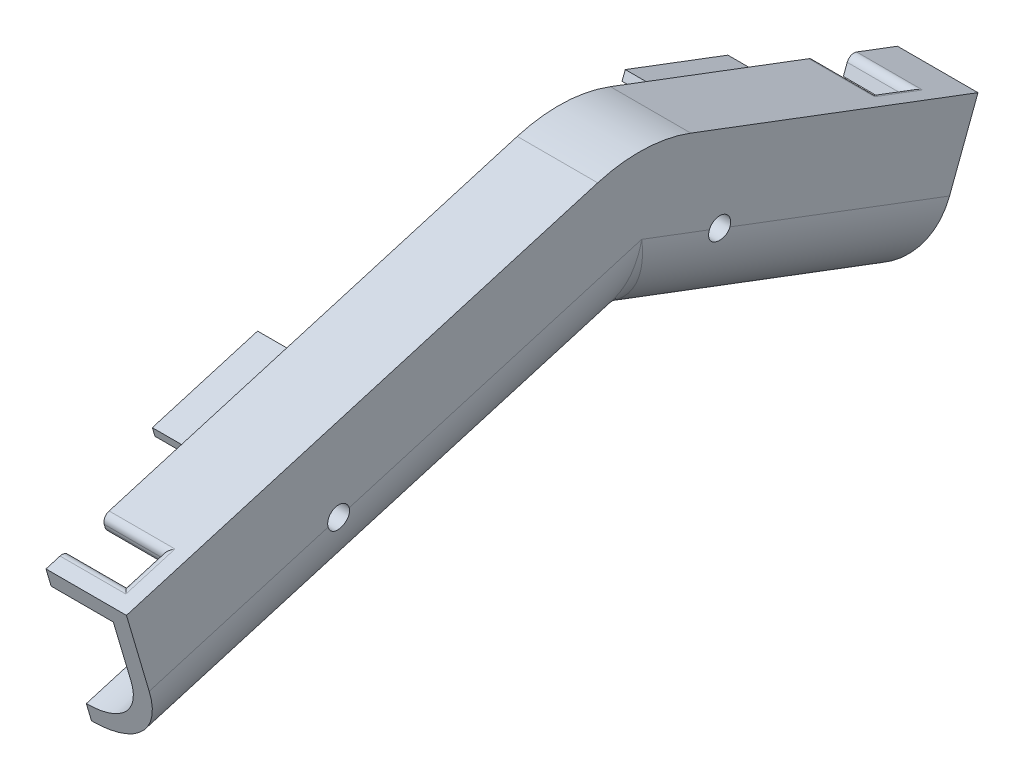
from build123d import *

# Parameters (mm, degrees)
SWEEP1_PROFILE_R        = 11
CUT_EXTRUDE1_DEPTH      = 139.5211963076765
CUT_EXTRUDE1_DEPTH_BACK = 139.5211963076765
BOSS_EXTRUDE1_DEPTH     = 11
BOSS_EXTRUDE4_DEPTH     = 11
SHELL1_START            = -11
SHELL1_DEPTH            = 11
SHELL1_START_2          = -113.150665538
SHELL1_2_DEPTH          = 47.855548818
SHELL1_START_3          = 20.420083618
SHELL1_3_DEPTH          = 73.048431747
FILLET1_R               = 6.5
BOSS_EXTRUDE2_DEPTH     = 3
CUT_EXTRUDE2_DEPTH      = 13.000000000000002
SKETCH21_R              = 2.499999999999935
SKETCH21_R_2            = 2.499999999999995
BOSS_EXTRUDE3_DEPTH     = 2
SKETCH22_R              = 1.4999999999999973
SKETCH22_R_2            = 1.5000000000000042
CUT_EXTRUDE3_DEPTH      = 160.1425622502868
FILLET2_R               = 3.75
CUT_EXTRUDE4_DEPTH      = 3
FILLET3_R               = 20
CUT_EXTRUDE5_DEPTH      = 3
FILLET4_R               = 1
CUT_EXTRUDE6_DEPTH      = 158.49217492446147
BOSS_EXTRUDE5_DEPTH     = 10
BOSS_EXTRUDE6_DEPTH     = 5
FILLET5_R               = 1


with BuildPart() as part:
    # Sweep1: sweep along a path in Sketch6
    with BuildLine(Plane(origin=(0, 0, 0), x_dir=(0, 0, -1), z_dir=(1, 0, 0))) as sweep1_path:
        Line((17.67333262983066, 12.262734264551655), (84.99999999999999, 32.11621443102775))
        Line((84.99999999999999, 32.11621443102775), (127.09238599616681, 16.202979651458282))
    # Sweep1 profile (on start of the path) → Sweep1 (sweep)
    with BuildSketch(Plane(origin=(0, 12.262734264551655, -17.67333262983066), x_dir=(0, -0.9591665787285488, -0.28284178306991825), z_dir=(0, 0.28284178306991825, -0.9591665787285488))):
        Circle(SWEEP1_PROFILE_R)
    sweep(path=sweep1_path.line, transition=Transition.RIGHT)

    # Sketch13 → Cut-Extrude1 (cut, two sides: drawn at the far end of the back side and taken through both)
    with BuildSketch(Plane(origin=(0, 0, 0), x_dir=(1, 0, 0), z_dir=(0, 1, 0)).offset(-CUT_EXTRUDE1_DEPTH_BACK)):
        Polygon((-1.735e-14, 141.7207506217034), (-10.000000000000018, 141.7207506217034), (-10, -2.41e-15), (0, -1.18e-15), align=None)
    extrude(amount=CUT_EXTRUDE1_DEPTH + CUT_EXTRUDE1_DEPTH_BACK, mode=Mode.SUBTRACT)


with BuildPart() as cut_extrude1_piece_1:
    # of the separate pieces the step leaves, piece 1, a body of its own (cut_extrude1_pieces)
    add(part.part.solids().sort_by_distance((0, 22.813566631, -14.562073016))[0])



with BuildPart() as cut_extrude1_piece_2:
    # of the separate pieces the step leaves, piece 2, a body of its own (cut_extrude1_pieces)
    add(part.part.solids().sort_by_distance((-10, 7.867280813, -18.96947651))[0])


with BuildPart() as cut_extrude1_piece_1_1:
    add(cut_extrude1_piece_1.part)

    add(cut_extrude1_piece_2.part)  # Boss-Extrude1 merges Cut-Extrude1 piece 2
    # Sketch17 → Boss-Extrude1 (add)
    with BuildSketch(Plane(origin=(0, 0, 0), x_dir=(0, 0, -1), z_dir=(1, 0, 0))):
        Polygon((14.562073016061587, 22.813566630565735), (85.43326002077312, 43.71226488094253), (130.98228783117273, 26.4922295616324), (123.20248416116098, 5.91372974128417), (84.56673997922682, 20.52016398111302), (20.78459224359979, 1.7119018985376593), align=None)
    extrude(amount=-BOSS_EXTRUDE1_DEPTH)

    # Sketch24 → Boss-Extrude4 (add)
    with BuildSketch(Plane(origin=(0, 0, 0), x_dir=(0, 0, -1), z_dir=(1, 0, 0))):
        Polygon((127.09238599616687, 16.20297965145829), (84.99999999999997, 32.11621443102777), (17.673332629830696, 12.2627342645517), (14.5620730160616, 22.813566630565738), (85.43326002077312, 43.71226488094253), (130.98228783117273, 26.4922295616324), align=None)
    extrude(amount=BOSS_EXTRUDE4_DEPTH)

    # Shell1: read off the stored shape, not the designer's step
    # Shell1 outline → Shell1 (cut)
    with BuildSketch(Plane.YZ.offset(SHELL1_START)):
        Polygon((4.109818345, -20.077487786), (23.155629992, -84.665208166), (8.25219563, -124.08655276), (24.153763673, -130.098219232), (41.07679887, -85.334791834), (20.415650184, -15.269177474), align=None)
    extrude(amount=SHELL1_DEPTH, mode=Mode.SUBTRACT)

    # Shell1 2 outline → Shell1 2 (cut)
    with BuildSketch(Plane(origin=(0, 0, 0), x_dir=(1, 0, 0), z_dir=(0, 0.353627439545988, 0.935386355470374)).offset(SHELL1_START_2)):
        with BuildLine():
            ThreePointArc((0, 51.59940113), (6.01040764, 54.088993489), (8.5, 60.09940113))
            Line((8.5, 60.09940113), (8.5, 68.59940113))
            Line((8.5, 68.59940113), (0, 68.59940113))
            Line((0, 68.59940113), (0, 51.59940113))
        make_face()
    extrude(amount=SHELL1_2_DEPTH, mode=Mode.SUBTRACT)

    # Shell1 3 outline → Shell1 3 (cut)
    with BuildSketch(Plane(origin=(0, 0, 0), x_dir=(1, 0, 0), z_dir=(0, 0.2828417830699179, -0.9591665787285488)).offset(SHELL1_START_3)):
        with BuildLine():
            Line((8.5, -15.263247957), (8.5, -6.763247957))
            ThreePointArc((8.5, -6.763247957), (6.01040764, -0.752840317), (0, 1.736752043))
            Line((0, 1.736752043), (0, -15.263247957))
            Line((0, -15.263247957), (8.5, -15.263247957))
        make_face()
    extrude(amount=SHELL1_3_DEPTH, mode=Mode.SUBTRACT)

    # Fillet1
    fillet1_edges = [cut_extrude1_piece_1_1.edges().sort_by_distance(p)[0] for p in [
        (7.881335387835811, 24.026781093815067, -84.69775674305134),
        (6.090122796410721, 25.865288676138242, -84.76644839135132),
        (-5.5, 23.155629992, -84.665208166),
        (-5.5, 20.52016398111302, -84.56673997922682),
    ]]
    fillet(fillet1_edges, radius=FILLET1_R)

    # Sketch19 → Boss-Extrude2 (add)
    with BuildSketch(Plane(origin=(-11, 0, 0), x_dir=(0, 0, -1), z_dir=(1, 0, 0))):
        Polygon((23.326841994418306, 17.839501416273155), (61.69350514356026, 29.153172739069877), (63.814818516584644, 21.959423398605768), (25.44815536744269, 10.645752075809039), align=None)
        with BuildLine():
            Line((82.27394375020691, 30.863769892150234), (86.9487114072542, 20.688724856427108))
            Line((86.9487114072542, 20.688724856427108), (97.3098397387939, 16.771649028602706))
            Line((97.3098397387939, 16.771649028602706), (109.44211139391379, 26.082981771484846))
            Line((109.44211139391379, 26.082981771484846), (86.06088152658778, 34.92237140237257))
            ThreePointArc((86.06088152658778, 34.92237140237257), (82.80654161714303, 34.162852377504095), (82.27394375020691, 30.863769892150234))
        make_face()
    extrude(amount=-BOSS_EXTRUDE2_DEPTH)


with BuildPart() as boss_extrude2_piece_1:
    # of the separate pieces the step leaves, piece 1, a body of its own (boss_extrude2_pieces)
    add(cut_extrude1_piece_1_1.part.solids().sort_by_distance((-1e-09, 22.538001125, -82.570719291))[0])

    # Sketch20 → Cut-Extrude2 (cut)
    with BuildSketch(Plane(origin=(0, 45.92690987835062, -17.362895504685262), x_dir=(1, 0, 0), z_dir=(0, -0.9353863554703739, 0.3536274395459883))):
        Polygon((-11.00000000000001, -75.16519001409192), (3.999999999999988, -75.16519001409192), (3.9999999999999916, -85.1651900140919), (-11.00000000000001, -85.1651900140919), align=None)
    extrude(amount=-CUT_EXTRUDE2_DEPTH, mode=Mode.SUBTRACT)



with BuildPart() as boss_extrude2_piece_2:
    # of the separate pieces the step leaves, piece 2, a body of its own (boss_extrude2_pieces)
    add(cut_extrude1_piece_1_1.part.solids().sort_by_distance((-11, 17.839501416, -23.326841994))[0])


with BuildPart() as boss_extrude2_piece_1_1:
    add(boss_extrude2_piece_1.part)

    add(boss_extrude2_piece_2.part)  # Boss-Extrude3 merges Boss-Extrude2 piece 2
    # Sketch21 → Boss-Extrude3 (add)
    # profile 1 of 2: a face of its own
    with BuildSketch(Plane.ZY.offset(11)):
        with BuildLine():
            Line((-59.92574399937327, 35.14796385612329), (-14.844914799131477, 21.85440005183715))
            Line((-14.844914799131477, 21.85440005183715), (-15.269177473736278, 20.4156501837443))
            Line((-15.269177473736278, 20.4156501837443), (-7.49992818603503, 18.124631740877966))
            ThreePointArc((-7.49992818603503, 18.124631740877966), (-3.391731998282636, 14.806195907785265), (-2.833287095990472, 9.554774044468546))
            Line((-2.833287095990472, 9.554774044468546), (-3.738380801814209, 6.4854409925371845))
            ThreePointArc((-3.738380801814209, 6.4854409925371845), (-7.056816634906908, 2.377244804784792), (-12.308238498223627, 1.8187999024926287))
            Line((-12.308238498223627, 1.8187999024926287), (-20.07748778592488, 4.1098183453589545))
            Line((-20.07748778592488, 4.1098183453589545), (-20.501750460529845, 2.6710684772661613))
            Line((-20.501750460529845, 2.6710684772661613), (-65.58257966077163, 15.964632281552323))
            Line((-65.58257966077163, 15.964632281552323), (-59.92574399937327, 35.14796385612329))
        make_face()
        with Locations((-10.000000000002185, 9.999999999992289)):
            Circle(SKETCH21_R, mode=Mode.SUBTRACT)
    # profile 2 of 2: a face of its own
    with BuildSketch(Plane.ZY.offset(11)):
        with BuildLine():
            Line((-97.3098397387939, 16.771649028602706), (-97.8402808981129, 18.1747285618083))
            Line((-97.8402808981129, 18.1747285618083), (-140.4938987075619, 2.049317318511217))
            ThreePointArc((-140.4938987075619, 2.049317318511217), (-145.77235119424373, 2.21433744231316), (-149.3880938931748, 6.0634538383894725))
            Line((-149.3880938931748, 6.0634538383894725), (-150.519701699722, 9.056690175894678))
            ThreePointArc((-150.519701699722, 9.056690175894678), (-150.35468157592004, 14.33514266257649), (-146.50556517984373, 17.95088536150758))
            Line((-146.50556517984373, 17.95088536150758), (-103.85194737039468, 34.07629660480464))
            Line((-103.85194737039468, 34.07629660480464), (-104.38238852971367, 35.479376138010196))
            Line((-104.38238852971367, 35.479376138010196), (-94.02126019817398, 39.39645196583461))
            Line((-94.02126019817398, 39.39645196583461), (-86.9487114072542, 20.688724856427108))
            Line((-86.9487114072542, 20.688724856427108), (-97.3098397387939, 16.771649028602706))
        make_face()
        with Locations((-143.4999999999837, 10.000000000006171)):
            Circle(SKETCH21_R_2, mode=Mode.SUBTRACT)
    extrude(amount=-BOSS_EXTRUDE3_DEPTH)

    # Sketch22 → Cut-Extrude3 (cut, through all)
    with BuildSketch(Plane.ZY.offset(13.999999999999998)):
        with Locations((-95.66554996848392, 28.084050497218655)):
            Circle(SKETCH22_R)
        with Locations(Location((-43.57083025550148, 19.89946240743944, 0), (0, 0, 343.570115329))):
            Circle(SKETCH22_R_2)
    extrude(amount=-CUT_EXTRUDE3_DEPTH, mode=Mode.SUBTRACT)

    # Fillet2
    fillet2_edges = [boss_extrude2_piece_1_1.edges().sort_by_distance(p)[0] for p in [
        (-12.5, 10.645752075809039, -25.44815536744269),
        (-12.5, 17.839501416273155, -23.326841994418306),
        (-12.5, 21.959423398605768, -63.814818516584644),
        (-12.5, 29.153172739069877, -61.69350514356026),
        (-12.5, 26.082981771484846, -109.44211139391379),
    ]]
    fillet(fillet2_edges, radius=FILLET2_R - 0.0001)  # a hair under: the kernel refuses the full size

    # Sketch23 → Cut-Extrude4 (cut)
    with BuildSketch(Plane(origin=(0, 17.03791376961812, 5.024188725151693), x_dir=(1, 0, 0), z_dir=(0, 0.9591665787285488, 0.28284178306991814))):
        Polygon((-11, 23.42008361798458), (8, 23.42008361798471), (8, 28.420083617984712), (-11, 28.420083617984712), align=None)
    extrude(amount=-CUT_EXTRUDE4_DEPTH, mode=Mode.SUBTRACT)

    # Fillet3
    fillet3_edges = [boss_extrude2_piece_1_1.edges().sort_by_distance(p)[0] for p in [
        (0, 43.71226488094253, -85.43326002077312),
        (-5.5, 41.07679887, -85.334791834),
    ]]
    fillet(fillet3_edges, radius=FILLET3_R)

    # Sketch25 → Cut-Extrude5 (cut)
    with BuildSketch(Plane(origin=(0, 66.50540969869884, -25.14269917469699), x_dir=(1, 0, 0), z_dir=(0, 0.9353863554703737, -0.35362743954598813))):
        Polygon((-11, 101.17418781590268), (8, 101.17418781590271), (8, 106.17418781590271), (-11, 106.17418781590268), align=None)
    extrude(amount=-CUT_EXTRUDE5_DEPTH, mode=Mode.SUBTRACT)

    # Fillet4
    fillet4_edges = [boss_extrude2_piece_1_1.edges().sort_by_distance(p)[0] for p in [
        (-4.5, 22.678384448496875, -22.942510103507807),
        (-1.5, 23.66209197977548, -17.439572752247173),
        (8, 24.36919643745029, -19.837489199068607),
        (-1.5, 25.076300895125087, -22.235405645889983),
        (-4.5, 28.38897482456117, -118.89558538463221),
        (-1.5, 30.727440713216254, -119.77965398348931),
        (8, 29.843372114351283, -122.11811987216527),
        (-1.5, 28.95930351548631, -124.45658576084118),
    ]]
    fillet(fillet4_edges, radius=FILLET4_R)

    # Sketch26 → Cut-Extrude6 (cut, through all)
    with BuildSketch(Plane(origin=(0, 0, 0), x_dir=(0, 0, -1), z_dir=(1, 0, 0))):
        Polygon((-14.446633314427679, 64.99999999999999), (165.5533666855723, 65.00000000000001), (165.55336668557234, -24.99999999999997), (-14.446633314427677, -25.000000000000004), align=None)
    extrude(amount=-CUT_EXTRUDE6_DEPTH, mode=Mode.SUBTRACT)

    # Sketch27 → Boss-Extrude5 (add)
    with BuildSketch(Plane(origin=(0, 0, 0), x_dir=(0, 0, -1), z_dir=(1, 0, 0))):
        with BuildLine():
            Line((32.81701767392019, 24.547635700274345), (79.17305246359051, 38.21723577468659))
            ThreePointArc((79.17305246359051, 38.21723577468659), (85.25644310208308, 38.97982290333003), (91.26596769329274, 37.765411532781265))
            Line((91.26596769329274, 37.765411532781265), (109.18809439037466, 30.9898628645298))
            Line((109.18809439037466, 30.9898628645298), (108.65765323105568, 29.58678333132425))
            Line((108.65765323105568, 29.58678333132425), (90.73552653397374, 36.36233199957569))
            ThreePointArc((90.73552653397374, 36.36233199957569), (85.2004380947017, 37.48086878823905), (79.59731513819537, 36.77848590659377))
            Line((79.59731513819537, 36.77848590659377), (33.241280348525066, 23.10888583218152))
            Line((33.241280348525066, 23.10888583218152), (32.81701767392019, 24.547635700274345))
        make_face()
    extrude(amount=BOSS_EXTRUDE5_DEPTH)

    # Sketch28 → Boss-Extrude6 (add)
    with BuildSketch(Plane.ZY):
        Polygon((-34.45250904830736, 26.072485845142726), (-34.09895681946996, 27.27144406855341), (-48.486455500398186, 31.51407081460221), (-48.840007729235595, 30.315112591191493), align=None)
        Polygon((-112.34788089633176, 30.864366901362214), (-112.78991519576422, 32.033599845700195), (-98.75911986370855, 37.338011438889865), (-98.31708556427617, 36.16877849455203), align=None)
        Polygon((-72.83164961599518, 19.66611641420453), (-73.18520184483259, 18.467158190793846), (-58.79770316390435, 14.224531444745073), (-58.44415093506696, 15.423489668155758), align=None)
    extrude(amount=BOSS_EXTRUDE6_DEPTH)

    # Fillet5
    # the kernel refuses this fillet: 1 mm, written as the material it takes off along each edge
    with BuildSketch(Plane(origin=(-2.5000000000000187, 24.547635700274345, -32.81701767392019), x_dir=(0, 0.28284178306991736, -0.9591665787285492), z_dir=(1, 0, 0))) as fillet5_piece_1:
        with BuildLine():
            CenterArc((FILLET5_R, -FILLET5_R), FILLET5_R, 90.00000000000011, 89.9999999999998)
            Line((9.82e-15, -FILLET5_R), (0, 0))
            Line((0, 0), (FILLET5_R, -2e-17))
        make_face()
    extrude(amount=11.000000000000018, mode=Mode.SUBTRACT)
    with BuildSketch(Plane(origin=(-2.5000000000000187, 23.10888583218152, -33.241280348525066), x_dir=(0, 0.28284178306991736, -0.9591665787285492), z_dir=(1, 0, 0))) as fillet5_piece_2:
        with BuildLine():
            CenterArc((FILLET5_R, FILLET5_R), FILLET5_R, 179.99999999999991, 90.00000000000023)
            Line((5.81e-15, FILLET5_R), (0, 0))
            Line((0, 0), (FILLET5_R, -2e-17))
        make_face()
    extrude(amount=11.000000000000018, mode=Mode.SUBTRACT)
    with BuildSketch(Plane(origin=(-2.500000000000001, 30.9898628645298, -109.18809439037466), x_dir=(0, 0.35362743954598624, 0.9353863554703745), z_dir=(1, 0, 0))) as fillet5_piece_3:
        with BuildLine():
            CenterArc((FILLET5_R, FILLET5_R), FILLET5_R, 180, 89.99999999999989)
            Line((2.09e-15, FILLET5_R), (0, 0))
            Line((0, 0), (FILLET5_R, -5e-17))
        make_face()
    extrude(amount=11, mode=Mode.SUBTRACT)
    with BuildSketch(Plane(origin=(-2.499999999999985, 29.58678333132425, -108.65765323105568), x_dir=(0, 0.9353863554703729, -0.3536274395459906), z_dir=(1, 0, 0))) as fillet5_piece_4:
        with BuildLine():
            CenterArc((FILLET5_R, FILLET5_R), FILLET5_R, 180.00000000000097, 89.99999999999892)
            Line((-2.92e-15, FILLET5_R), (0, 0))
            Line((0, 0), (FILLET5_R, 0))
        make_face()
    extrude(amount=10.999999999999986, mode=Mode.SUBTRACT)


solid = boss_extrude2_piece_1_1.part
